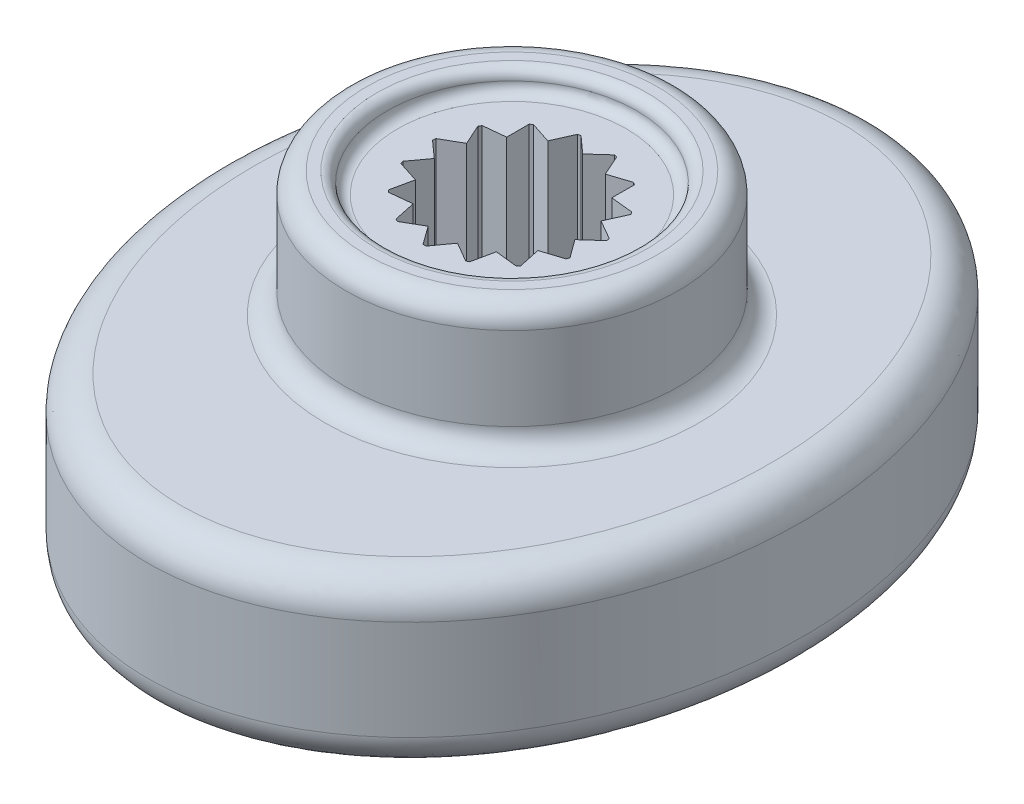
from build123d import *

# Parameters (mm, degrees)
BOSS_EXTRUDE1_DEPTH      = 2
BOSS_EXTRUDE1_DEPTH_BACK = 2
SKETCH1_RX               = 8.75
SKETCH1_RY               = 7
SKETCH1_R                = 0.75
FILLET1_R                = 0.8
SKETCH2_R                = 4
SKETCH2_R_2              = 2.1
BOSS_EXTRUDE2_DEPTH      = 3
CUT_EXTRUDE2_START       = -1
SKETCH5_R                = 2.1
CUT_EXTRUDE2_DEPTH       = 1
BOSS_EXTRUDE3_DEPTH      = 3.5
FILLET2_R                = 0.5
CUT_EXTRUDE3_START       = -0.5
SKETCH6_R                = 3
SKETCH6_R_2              = 2.1
CUT_EXTRUDE3_DEPTH       = 0.5
FILLET3_R                = 0.25


with BuildPart() as part:
    # Sketch1 → Boss-Extrude1 (new, two sides: drawn at the far end of the back side and taken through both)
    with BuildSketch(Plane(origin=(0, 0, 0), x_dir=(1, 0, 0), z_dir=(0, 1, 0)).offset(-BOSS_EXTRUDE1_DEPTH_BACK)):
        with Locations(Location((0, 0), (0, 0, 90))):
            Ellipse(SKETCH1_RX, SKETCH1_RY)
        with Locations(Location((0, 0, 0), (0, 0, 270))):
            Circle(SKETCH1_R, mode=Mode.SUBTRACT)
    extrude(amount=BOSS_EXTRUDE1_DEPTH + BOSS_EXTRUDE1_DEPTH_BACK)

    # Fillet1
    fillet1_edges = [part.edges().sort_by_distance(p)[0] for p in [
        (0.001095264, -2, 8.749999893),
        (0.001095264, 2, 8.749999893),
    ]]
    fillet(fillet1_edges, radius=FILLET1_R)

    # Sketch2 → Boss-Extrude2 (add)
    with BuildSketch(Plane(origin=(0, 2, 0), x_dir=(1, 0, 0), z_dir=(0, 1, 0))):
        with Locations(Location((0, 0, 0), (0, 0, 90))):
            Circle(SKETCH2_R)
        with Locations(Location((0, 0, 0), (0, 0, 90))):
            Circle(SKETCH2_R_2, mode=Mode.SUBTRACT)
    extrude(amount=BOSS_EXTRUDE2_DEPTH)

    # Sketch5 → Cut-Extrude2 (cut)
    with BuildSketch(Plane(origin=(0, 2, 0), x_dir=(1, 0, 0), z_dir=(0, 1, 0)).offset(CUT_EXTRUDE2_START)):
        with Locations(Location((0, 0, 0), (0, 0, 90))):
            Circle(SKETCH5_R)
    extrude(amount=CUT_EXTRUDE2_DEPTH, mode=Mode.SUBTRACT)

    # Sketch4 → Boss-Extrude3 (add)
    with BuildSketch(Plane(origin=(0, 1, 0), x_dir=(1, 0, 0), z_dir=(0, 1, 0))):
        with BuildLine():
            Line((-0.4, 2.061552813), (0, 1.7))
            Line((0, 1.7), (0.4, 2.061552813))
            ThreePointArc((0.4, 2.061552813), (0, 2.1), (-0.4, 2.061552813))
        make_face()
        with BuildLine():
            Line((0.691452293, 1.553027278), (1.203927254, 1.720627551))
            ThreePointArc((1.203927254, 1.720627551), (0.85414695, 1.918445461), (0.473090888, 2.046016865))
            Line((0.473090888, 2.046016865), (0.691452293, 1.553027278))
        make_face()
        with BuildLine():
            Line((1.263346203, 1.137522031), (1.799684548, 1.082190153))
            ThreePointArc((1.799684548, 1.082190153), (1.560604134, 1.405174273), (1.264380063, 1.676706014))
            Line((1.264380063, 1.676706014), (1.263346203, 1.137522031))
        make_face()
        with BuildLine():
            Line((1.616796078, 0.52532889), (2.084260034, 0.256632247))
            ThreePointArc((2.084260034, 0.256632247), (1.997218684, 0.648935688), (1.837046439, 1.01747746))
            Line((1.837046439, 1.01747746), (1.616796078, 0.52532889))
        make_face()
        with BuildLine():
            Line((1.690687222, -0.177698388), (2.008448025, -0.613299706))
            ThreePointArc((2.008448025, -0.613299706), (2.08849598, -0.219509773), (2.092070796, 0.182317811))
            Line((2.092070796, 0.182317811), (1.690687222, -0.177698388))
        make_face()
        with BuildLine():
            Line((1.472243186, -0.85), (1.585357107, -1.377186568))
            ThreePointArc((1.585357107, -1.377186568), (1.818653348, -1.05), (1.985357107, -0.684366245))
            Line((1.985357107, -0.684366245), (1.472243186, -0.85))
        make_face()
        with BuildLine():
            Line((0.999234929, -1.37532889), (0.888143542, -1.902945361))
            ThreePointArc((0.888143542, -1.902945361), (1.23434903, -1.698935688), (1.535357138, -1.432717159))
            Line((1.535357138, -1.432717159), (0.999234929, -1.37532889))
        make_face()
        with BuildLine():
            Line((0.353449874, -1.662850921), (0.037361891, -2.099667614))
            ThreePointArc((0.037361891, -2.099667614), (0.436614551, -2.054109962), (0.819879971, -1.933338261))
            Line((0.819879971, -1.933338261), (0.353449874, -1.662850921))
        make_face()
        with BuildLine():
            Line((-0.353449874, -1.662850921), (-0.819879971, -1.933338261))
            ThreePointArc((-0.819879971, -1.933338261), (-0.436614551, -2.054109962), (-0.037361891, -2.099667614))
            Line((-0.037361891, -2.099667614), (-0.353449874, -1.662850921))
        make_face()
        with BuildLine():
            Line((-0.999234929, -1.37532889), (-1.535357138, -1.432717159))
            ThreePointArc((-1.535357138, -1.432717159), (-1.23434903, -1.698935688), (-0.888143542, -1.902945361))
            Line((-0.888143542, -1.902945361), (-0.999234929, -1.37532889))
        make_face()
        with BuildLine():
            Line((-1.472243186, -0.85), (-1.985357107, -0.684366245))
            ThreePointArc((-1.985357107, -0.684366245), (-1.818653348, -1.05), (-1.585357107, -1.377186568))
            Line((-1.585357107, -1.377186568), (-1.472243186, -0.85))
        make_face()
        with BuildLine():
            Line((-1.690687222, -0.177698388), (-2.092070796, 0.182317811))
            ThreePointArc((-2.092070796, 0.182317811), (-2.08849598, -0.219509773), (-2.008448025, -0.613299706))
            Line((-2.008448025, -0.613299706), (-1.690687222, -0.177698388))
        make_face()
        with BuildLine():
            Line((-1.616796078, 0.52532889), (-1.837046439, 1.01747746))
            ThreePointArc((-1.837046439, 1.01747746), (-1.997218684, 0.648935688), (-2.084260034, 0.256632247))
            Line((-2.084260034, 0.256632247), (-1.616796078, 0.52532889))
        make_face()
        with BuildLine():
            Line((-1.263346203, 1.137522031), (-1.264380063, 1.676706014))
            ThreePointArc((-1.264380063, 1.676706014), (-1.560604134, 1.405174273), (-1.799684548, 1.082190153))
            Line((-1.799684548, 1.082190153), (-1.263346203, 1.137522031))
        make_face()
        with BuildLine():
            Line((-0.691452293, 1.553027278), (-0.473090888, 2.046016865))
            ThreePointArc((-0.473090888, 2.046016865), (-0.85414695, 1.918445461), (-1.203927254, 1.720627551))
            Line((-1.203927254, 1.720627551), (-0.691452293, 1.553027278))
        make_face()
    extrude(amount=BOSS_EXTRUDE3_DEPTH)

    # Fillet2
    fillet2_edges = [part.edges().sort_by_distance(p)[0] for p in [
        (0, 2, 4),
        (0, 5, 4),
    ]]
    fillet(fillet2_edges, radius=FILLET2_R)

    # Sketch6 → Cut-Extrude3 (cut)
    with BuildSketch(Plane(origin=(0, 5, 0), x_dir=(1, 0, 0), z_dir=(0, 1, 0)).offset(CUT_EXTRUDE3_START)):
        with Locations(Location((0, 0, 0), (0, 0, 270))):
            Circle(SKETCH6_R)
        Circle(SKETCH6_R_2, mode=Mode.SUBTRACT)
    extrude(amount=CUT_EXTRUDE3_DEPTH, mode=Mode.SUBTRACT)

    # Fillet3
    fillet3_edges = [part.edges().sort_by_distance(p)[0] for p in [
        (0, 4.5, -3),
        (0, 5, -3),
    ]]
    fillet(fillet3_edges, radius=FILLET3_R - 0.0001)  # a hair under: the kernel refuses the full size


solid = part.part
